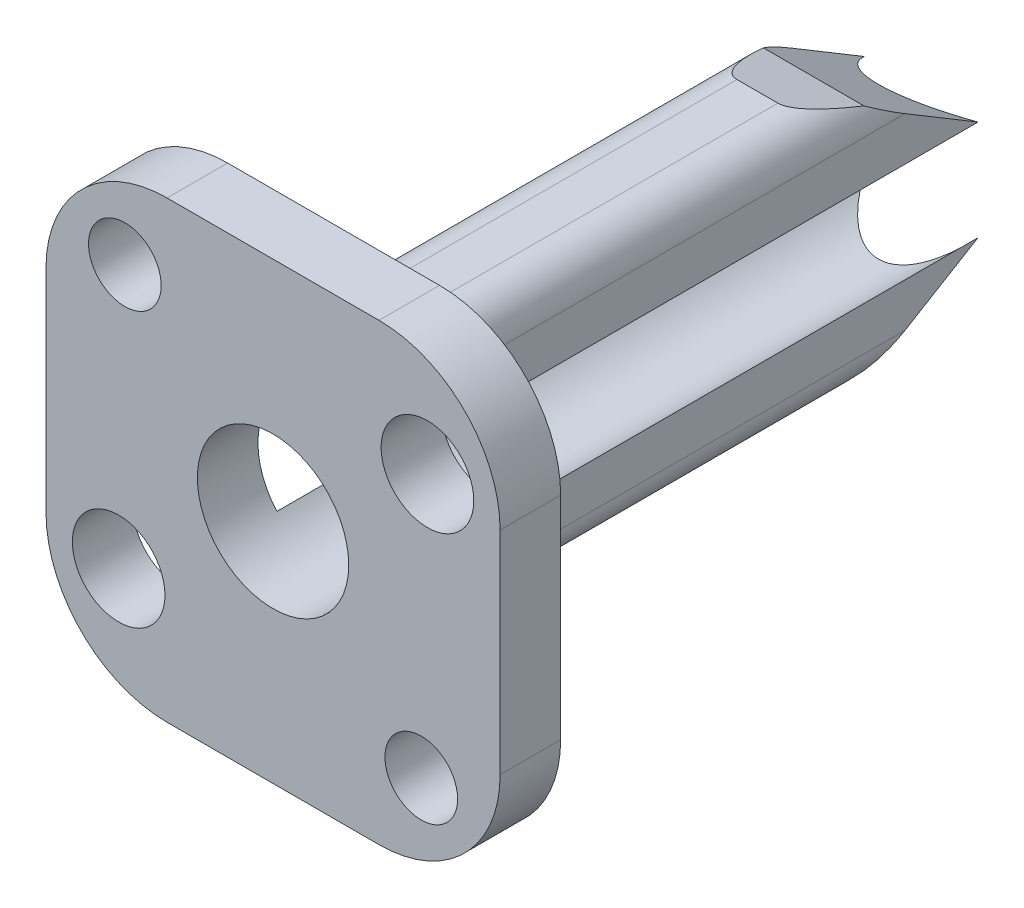
from build123d import *

# Parameters (mm, degrees)
CROQUIS2_W              = 75
CROQUIS2_H              = 75
SALIENTE_EXTRUIR1_DEPTH = 10
SALIENTE_EXTRUIR2_DEPTH = 100
CHAFL_N1_SIZE           = 25
CHAFL_N1_SIZE_2         = 15
CHAFL_N2_SIZE           = 25
CHAFL_N2_SIZE_2         = 15
CORTAR_EXTRUIR1_REACH   = 112.598
CHAFL_N3_SIZE           = 5
REDONDEO1_R             = 6
REDONDEO2_R             = 20
SKETCH1_R               = 7.65
SKETCH1_R_2             = 6
CUT_EXTRUDE2_DEPTH      = 10


with BuildPart() as part:
    # Croquis2 → Saliente-Extruir1 (new body)
    with BuildSketch(Plane(origin=(0, 0, 0), x_dir=(0, 1, 0), z_dir=(0, 0, 1))):
        Rectangle(CROQUIS2_W, CROQUIS2_H)
    extrude(amount=SALIENTE_EXTRUIR1_DEPTH)

    # Croquis2<3> → Saliente-Extruir2 (add)
    with BuildSketch(Plane(origin=(0, 0, 0), x_dir=(0, 1, 0), z_dir=(0, 0, 1))):
        with BuildLine():
            Line((-21.5, 9.375), (-21.5, -9.375))
            Line((-21.5, -9.375), (-8.267972847, -9.375))
            ThreePointArc((-8.267972847, -9.375), (-12.5, 0), (-8.267972847, 9.375))
            Line((-8.267972847, 9.375), (-21.5, 9.375))
        make_face()
        with BuildLine():
            ThreePointArc((8.267972847, 9.375), (12.5, 0), (8.267972847, -9.375))
            Line((8.267972847, -9.375), (21.5, -9.375))
            Line((21.5, -9.375), (21.5, 9.375))
            Line((21.5, 9.375), (8.267972847, 9.375))
        make_face()
    extrude(amount=-SALIENTE_EXTRUIR2_DEPTH)

    # Chaflán1
    # the kernel refuses this chamfer: 25, 15 mm, written as the material it takes off along each edge
    with BuildSketch(Plane(origin=(74.03152743, 21.5, -100), x_dir=(0, 0.01989341895858247, 0.9998021063601227), z_dir=(-1, 0, 0))) as chafl_n1_piece_1:
        Polygon((CHAFL_N1_SIZE * 0.99980210636, -CHAFL_N1_SIZE * 0.0198934189586), (-CHAFL_N1_SIZE_2 * 0.0198934189586, -CHAFL_N1_SIZE_2 * 0.99980210636), (0, 0), align=None)
    extrude(amount=148.06305486, mode=Mode.SUBTRACT)

    # Chaflán2
    # the kernel refuses this chamfer: 25, 15 mm, written as the material it takes off along each edge
    with BuildSketch(Plane(origin=(-74.03152743, -21.5, -100), x_dir=(0, -0.01989341895858247, 0.9998021063601227), z_dir=(1, 0, 0))) as chafl_n2_piece_1:
        Polygon((CHAFL_N2_SIZE * 0.99980210636, -CHAFL_N2_SIZE * 0.0198934189586), (-CHAFL_N2_SIZE_2 * 0.0198934189586, -CHAFL_N2_SIZE_2 * 0.99980210636), (0, 0), align=None)
    extrude(amount=148.06305486, mode=Mode.SUBTRACT)

    # Croquis2<4> → Cortar-Extruir1 (cut, up to next)
    with BuildSketch(Plane(origin=(0, 0, 0), x_dir=(0, 1, 0), z_dir=(0, 0, 1)), mode=Mode.PRIVATE) as cortar_extruir1_sk1:
        with BuildLine():
            ThreePointArc((-8.267972847, 9.375), (-12.5, 0), (-8.267972847, -9.375))
            Line((-8.267972847, -9.375), (8.267972847, -9.375))
            ThreePointArc((8.267972847, -9.375), (11.392972847, -5.142972847), (12.5, 0))
            ThreePointArc((12.5, 0), (11.392972847, 5.142972847), (8.267972847, 9.375))
            Line((8.267972847, 9.375), (-8.267972847, 9.375))
        make_face()
    cortar_extruir1_tool1 = extrude(cortar_extruir1_sk1.sketch, amount=CORTAR_EXTRUIR1_REACH, mode=Mode.PRIVATE) & part.part
    # Croquis2<4> → Cortar-Extruir1 (cut, up to next)
    with BuildSketch(Plane(origin=(0, 0, 0), x_dir=(0, 1, 0), z_dir=(0, 0, 1)), mode=Mode.PRIVATE) as cortar_extruir1_sk2:
        with BuildLine():
            Line((8.267972847, -9.375), (-8.267972847, -9.375))
            ThreePointArc((-8.267972847, -9.375), (0, -12.5), (8.267972847, -9.375))
        make_face()
    cortar_extruir1_tool2 = extrude(cortar_extruir1_sk2.sketch, amount=CORTAR_EXTRUIR1_REACH, mode=Mode.PRIVATE) & part.part
    # Croquis2<4> → Cortar-Extruir1 (cut, up to next)
    with BuildSketch(Plane(origin=(0, 0, 0), x_dir=(0, 1, 0), z_dir=(0, 0, 1)), mode=Mode.PRIVATE) as cortar_extruir1_sk3:
        with BuildLine():
            ThreePointArc((8.267972847, 9.375), (0, 12.5), (-8.267972847, 9.375))
            Line((-8.267972847, 9.375), (8.267972847, 9.375))
        make_face()
    cortar_extruir1_tool3 = extrude(cortar_extruir1_sk3.sketch, amount=CORTAR_EXTRUIR1_REACH, mode=Mode.PRIVATE) & part.part
    add(cortar_extruir1_tool1.solids().sort_by_distance((0, 0, 0))[0], mode=Mode.SUBTRACT)
    add(cortar_extruir1_tool2.solids().sort_by_distance((10.639442, 0, 0))[0], mode=Mode.SUBTRACT)
    add(cortar_extruir1_tool3.solids().sort_by_distance((-10.639442, 0, 0))[0], mode=Mode.SUBTRACT)

    # Chaflán3
    chafl_n3_edges = [part.edges().sort_by_distance(p)[0] for p in [
        (0, 21.5, -75),
        (0, -21.5, -75),
    ]]
    chamfer(chafl_n3_edges, length=CHAFL_N3_SIZE)

    # Redondeo1
    redondeo1_edges = [part.edges().sort_by_distance(p)[0] for p in [
        (-9.375, -21.5, -35),
        (9.375, -21.5, -35),
        (9.375, 21.5, -35),
        (-9.375, 21.5, -35),
    ]]
    fillet(redondeo1_edges, radius=REDONDEO1_R)

    # Redondeo2
    redondeo2_edges = [part.edges().sort_by_distance(p)[0] for p in [
        (37.5, -37.5, 5),
        (-37.5, -37.5, 5),
        (-37.5, 37.5, 5),
        (37.5, 37.5, 5),
    ]]
    fillet(redondeo2_edges, radius=REDONDEO2_R)

    # Sketch1 → Cut-Extrude2 (cut)
    with BuildSketch(Plane.XY.offset(10)):
        with Locations((25.5, 19.5)):
            Circle(SKETCH1_R)
        with Locations((-24.48, 24.48)):
            Circle(SKETCH1_R_2)
        with Locations((-25.5, -19.5)):
            Circle(SKETCH1_R)
        with Locations((24.48, -24.48)):
            Circle(SKETCH1_R_2)
    extrude(amount=-CUT_EXTRUDE2_DEPTH, mode=Mode.SUBTRACT)


solid = part.part
